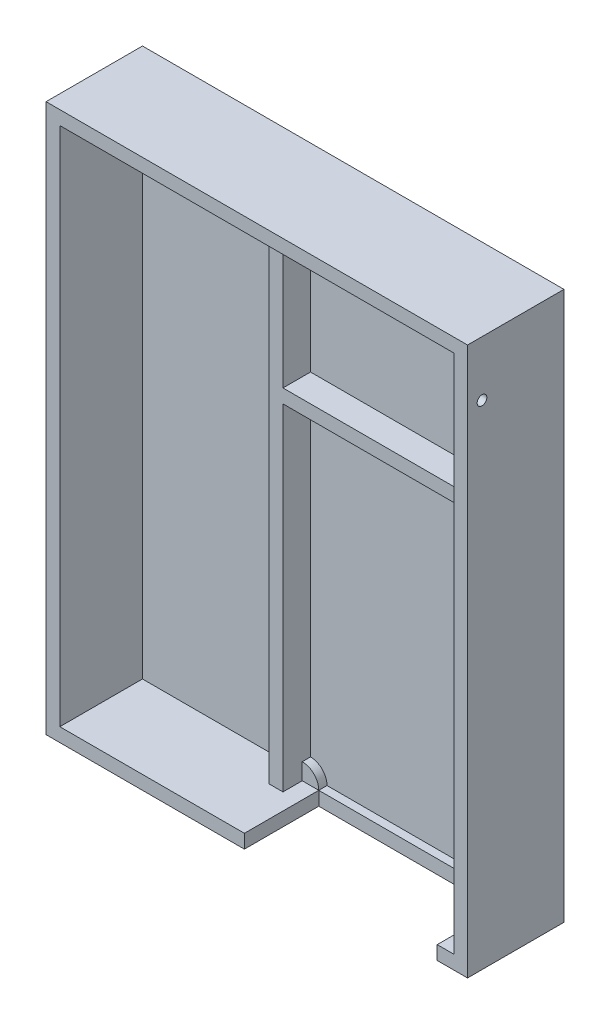
from build123d import *

# Parameters (mm, degrees)
SKETCH1_W           = 199
SKETCH1_H           = 153
BOSS_EXTRUDE1_DEPTH = 5
SKETCH2_W           = 153
SKETCH2_H           = 199
SKETCH2_W_2         = 82
SKETCH2_H_2         = 122
SKETCH2_H_3         = 62
SKETCH2_W_3         = 56
SKETCH2_H_4         = 189
BOSS_EXTRUDE2_DEPTH = 10
SKETCH3_W           = 153
SKETCH3_H           = 199
SKETCH3_W_2         = 143
SKETCH3_H_2         = 189
BOSS_EXTRUDE3_DEPTH = 20
SKETCH4_W           = 6
SKETCH4_H           = 6
BOSS_EXTRUDE4_DEPTH = 3
FILLET1_R           = 6
SKETCH5_W           = 70
SKETCH5_H           = 5
CUT_EXTRUDE1_DEPTH  = 27
SKETCH6_R           = 1.75
CUT_EXTRUDE2_DEPTH  = 5


with BuildPart() as part:
    # Sketch1 → Boss-Extrude1 (new body)
    with BuildSketch(Plane(origin=(0, 0, 0), x_dir=(0, 1, 0), z_dir=(0, 0, 1))):
        with Locations((99.5, 76.5)):
            Rectangle(SKETCH1_W, SKETCH1_H)
    extrude(amount=-BOSS_EXTRUDE1_DEPTH)

    # Sketch2 → Boss-Extrude2 (add)
    with BuildSketch(Plane.XY):
        with Locations((-76.5, 99.5)):
            Rectangle(SKETCH2_W, SKETCH2_H)
        with Locations((-46, 66)):
            Rectangle(SKETCH2_W_2, SKETCH2_H_2, mode=Mode.SUBTRACT)
        with Locations((-46, 163)):
            Rectangle(SKETCH2_W_2, SKETCH2_H_3, mode=Mode.SUBTRACT)
        with Locations((-120, 99.5)):
            Rectangle(SKETCH2_W_3, SKETCH2_H_4, mode=Mode.SUBTRACT)
    extrude(amount=BOSS_EXTRUDE2_DEPTH)

    # Sketch3 → Boss-Extrude3 (add)
    with BuildSketch(Plane.XY.offset(10)):
        with Locations((-76.5, 99.5)):
            Rectangle(SKETCH3_W, SKETCH3_H)
        with Locations((-76.5, 99.5)):
            Rectangle(SKETCH3_W_2, SKETCH3_H_2, mode=Mode.SUBTRACT)
    extrude(amount=BOSS_EXTRUDE3_DEPTH)

    # Sketch4 → Boss-Extrude4 (add)
    with BuildSketch(Plane.XY):
        with Locations((-84, 124)):
            Rectangle(SKETCH4_W, SKETCH4_H)
        with Locations((-8, 124)):
            Rectangle(SKETCH4_W, SKETCH4_H)
        with Locations((-8, 8)):
            Rectangle(SKETCH4_W, SKETCH4_H)
        with Locations((-84, 8)):
            Rectangle(SKETCH4_W, SKETCH4_H)
    extrude(amount=BOSS_EXTRUDE4_DEPTH)

    # Fillet1
    fillet1_edges = [part.edges().sort_by_distance(p)[0] for p in [
        (-81, 11, 1.5),
        (-11, 11, 1.5),
        (-81, 121, 1.5),
        (-11, 121, 1.5),
    ]]
    fillet(fillet1_edges, radius=FILLET1_R - 0.0001)  # a hair under: the kernel refuses the full size

    # Sketch5 → Cut-Extrude1 (cut)
    with BuildSketch(Plane.XY.offset(30)):
        with Locations((-46, 2.5)):
            Rectangle(SKETCH5_W, SKETCH5_H)
    extrude(amount=-CUT_EXTRUDE1_DEPTH, mode=Mode.SUBTRACT)

    # Sketch6 → Cut-Extrude2 (cut)
    with BuildSketch(Plane(origin=(-5, 0, 0), x_dir=(0, -1, 0), z_dir=(-1, 0, 0))):
        with Locations((-179, 24.75)):
            Circle(SKETCH6_R)
    extrude(amount=-CUT_EXTRUDE2_DEPTH, mode=Mode.SUBTRACT)


solid = part.part
